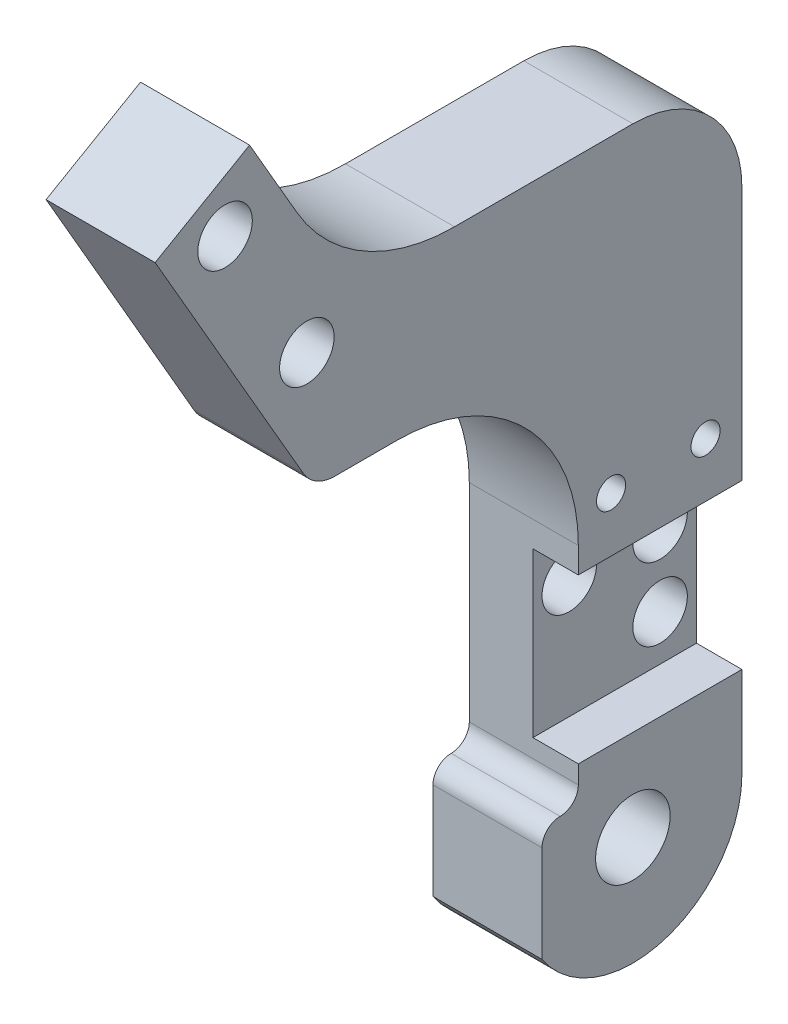
from build123d import *

# Parameters (mm, degrees)
SKETCH1_R                   = 2.05
SKETCH1_R_2                 = 1.5
BOSS_EXTRUDE1_DEPTH         = 6
FILLET1_START               = -1
FILLET1_DEPTH               = 8
FILLET1_2_DEPTH             = 6
TAP_DRILL_FOR_M2X0_4_TAP1_D = 1.6
SKETCH4_W                   = 9
SKETCH4_H                   = 9
CUT_EXTRUDE1_DEPTH          = 2.5
SKETCH5_R                   = 5
CUT_EXTRUDE2_DEPTH          = 4


with BuildPart() as part:
    # Sketch1 → Boss-Extrude1 (new body)
    with BuildSketch(Plane(origin=(0, 0, 0), x_dir=(0, 0, -1), z_dir=(1, 0, 0))):
        with BuildLine():
            Line((6, 0), (6, 28))
            ThreePointArc((6, 28), (4.242640687, 32.242640687), (0, 34))
            Line((0, 34), (-9.814222224, 34))
            ThreePointArc((-9.814222224, 34), (-14.814222224, 35.339745962), (-18.474476262, 39))
            Line((-18.474476262, 39), (-21.089872981, 43.53))
            Line((-21.089872981, 43.53), (-26.286025404, 40.53))
            Line((-26.286025404, 40.53), (-18.131025404, 26.405125664))
            ThreePointArc((-18.131025404, 26.405125664), (-17.398974596, 25.673074857), (-16.398974596, 25.405125664))
            Line((-16.398974596, 25.405125664), (-13, 25.405125664))
            ThreePointArc((-13, 25.405125664), (-5.928932188, 22.476193476), (-3, 15.405125664))
            Line((-3, 15.405125664), (-3, 3))
            Line((-3, 3), (-5, 3))
            Line((-5, 3), (-5, -3.31662479))
            ThreePointArc((-5, -3.31662479), (1.732050808, -5.744562647), (6, 0))
        make_face()
        Circle(SKETCH1_R, mode=Mode.SUBTRACT)
        with Locations((-22.437949192, 39.864936491)):
            Circle(SKETCH1_R_2, mode=Mode.SUBTRACT)
        with Locations((-17.937949192, 32.070707856)):
            Circle(SKETCH1_R_2, mode=Mode.SUBTRACT)
        with Locations((-1, 11.5)):
            Circle(SKETCH1_R_2, mode=Mode.SUBTRACT)
        with Locations((4, 11.5)):
            Circle(SKETCH1_R_2, mode=Mode.SUBTRACT)
        with Locations((4, 7.5)):
            Circle(SKETCH1_R_2, mode=Mode.SUBTRACT)
    extrude(amount=BOSS_EXTRUDE1_DEPTH)

    # Fillet1: read off the stored shape, not the designer's step
    # Fillet1 outline → Fillet1 (cut)
    with BuildSketch(Plane.YZ.offset(FILLET1_START)):
        with BuildLine():
            ThreePointArc((2, 5), (2.707106781, 4.707106781), (3, 4))
            Line((3, 4), (3, 5))
            Line((3, 5), (2, 5))
        make_face()
    extrude(amount=FILLET1_DEPTH, mode=Mode.SUBTRACT)

    # Fillet1 2 outline → Fillet1 2 (add)
    with BuildSketch(Plane.YZ):
        with BuildLine():
            ThreePointArc((4, 3), (3.292893219, 3.292893219), (3, 4))
            Line((3, 4), (3, 3))
            Line((3, 3), (4, 3))
        make_face()
    extrude(amount=FILLET1_2_DEPTH)

    # Tap Drill for M2x0.4 Tap1 (through all)
    with Locations(Plane(origin=(6, 0, 0), x_dir=(0, 0, -1), z_dir=(1, 0, 0))):
        with Locations((-1.2, 17), (4, 17)):
            Hole(TAP_DRILL_FOR_M2X0_4_TAP1_D / 2)

    # Sketch4 → Cut-Extrude1 (cut)
    with BuildSketch(Plane.ZY.offset(-6)):
        with Locations((-1.5, 9.5)):
            Rectangle(SKETCH4_W, SKETCH4_H)
    extrude(amount=CUT_EXTRUDE1_DEPTH, mode=Mode.SUBTRACT)

    # Sketch5 → Cut-Extrude2 (cut)
    with BuildSketch(Plane(origin=(0, 0, 0), x_dir=(0, 0, -1), z_dir=(1, 0, 0))):
        with Locations((0, 28)):
            Circle(SKETCH5_R)
    extrude(amount=CUT_EXTRUDE2_DEPTH, mode=Mode.SUBTRACT)


solid = part.part
